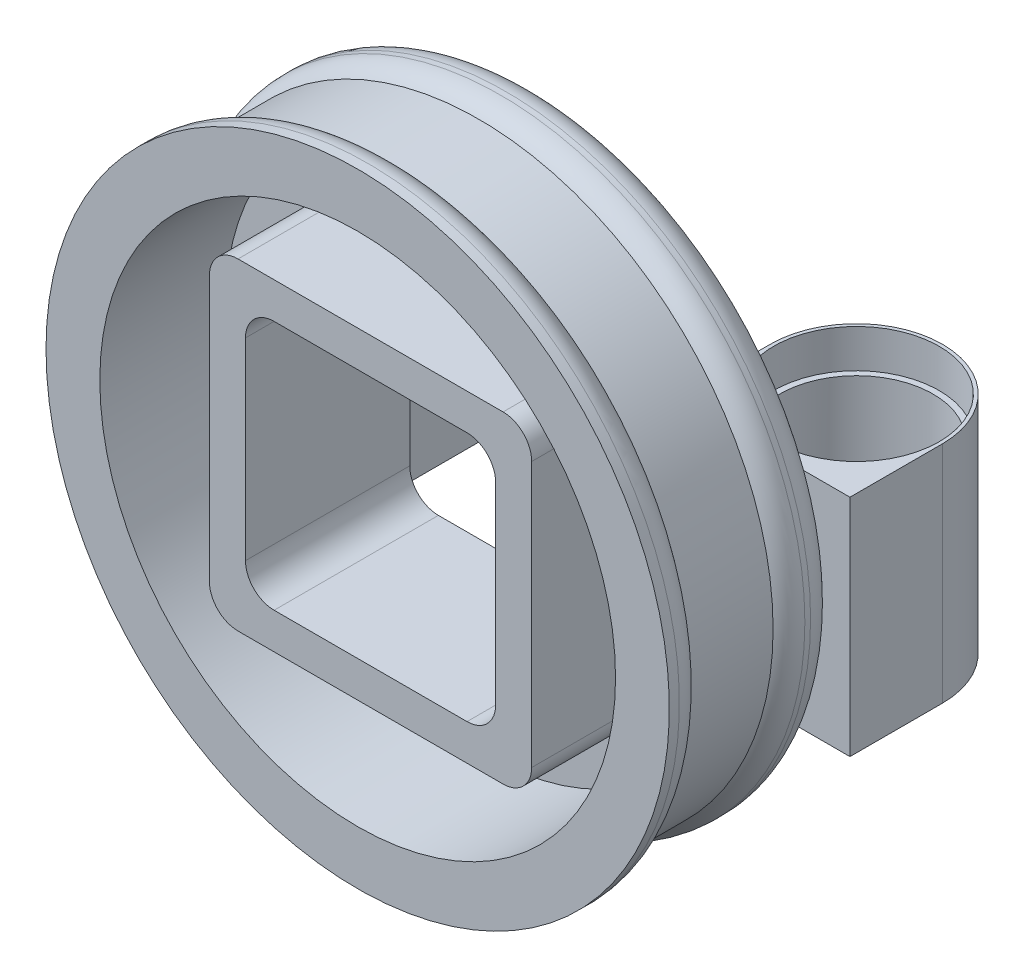
from build123d import *

# Parameters (mm, degrees)
FILLET3_R           = 1
CUT_EXTRUDE6_START  = -3.94
CUT_EXTRUDE6_DEPTH  = 3.94
FILLET5_R           = 1
CUT_EXTRUDE7_DEPTH  = 10.94
SKETCH14_W          = 7.26
SKETCH14_H          = 7.85
BOSS_EXTRUDE2_DEPTH = 6.47
CUT_EXTRUDE16_DEPTH = 16.47
SKETCH19_R          = 2.891830788
SKETCH19_R_2        = 2.68
CUT_EXTRUDE20_DEPTH = 1.34
CUT_EXTRUDE21_START = -1.34
SKETCH21_R          = 2.89
SKETCH21_R_2        = 2.68
CUT_EXTRUDE21_DEPTH = 1.34
SKETCH23_R          = 2.68
CUT_EXTRUDE22_DEPTH = 21.34


with BuildPart() as part:
    # Sketch1 → Revolve1 (revolve)
    with BuildSketch(Plane(origin=(0, 0, 0), x_dir=(1, 0, 0), z_dir=(0, 1, 0)), mode=Mode.PRIVATE) as revolve1_sk:
        Polygon((0, 5.74), (10.635, 5.74), (10.635, 3.78), (10.285, 3.78), (10.285, 0.82), (10.89, 0.82), (10.89, -0.45), (9.01, -0.45), (9.01, 0), (0, 0), align=None)
    revolve(revolve1_sk.sketch.rotate(Axis((0, 0, -20.772745763), (0, 0, 1)), 180), axis=Axis((0, 0, -20.772745763), (0, 0, 1)))

    # Fillet3
    # the kernel refuses this fillet: 1 mm, written as the material it takes off along each edge
    with BuildSketch(Plane(origin=(0, 0, -3.78), x_dir=(-1, 0, 0), z_dir=(0, 1, 0))) as fillet3_piece_1:
        with BuildLine():
            CenterArc((9.635, -0.759934208), FILLET3_R, 0, 49.458398126)
            Line((10.285, 0), (10.298, 0.015198684))
            ThreePointArc((10.298, 0.015198684), (10.46, 0.02), (10.635, 0.02))
            Line((10.635, 0.02), (10.655, 0))
            Line((10.655, 0), (10.655, -0.759934208))
            Line((10.655, -0.759934208), (10.635, -0.759934208))
        make_face()
    revolve(axis=Axis((0, 0, -3.78), (0, 0, 1)), mode=Mode.SUBTRACT)
    with BuildSketch(Plane(origin=(0, 0, -5.74), x_dir=(-1, 0, 0), z_dir=(0, 1, 0))) as fillet3_piece_2:
        with BuildLine():
            CenterArc((10.635 - FILLET3_R, FILLET3_R), FILLET3_R, 270, 90)
            Line((10.635, FILLET3_R), (10.635 + FILLET3_R * 0.02, FILLET3_R))
            Line((10.635 + FILLET3_R * 0.02, FILLET3_R), (10.635 + FILLET3_R * 0.02, -FILLET3_R * 0.02))
            Line((10.635 + FILLET3_R * 0.02, -FILLET3_R * 0.02), (10.635 - FILLET3_R, -FILLET3_R * 0.02))
            Line((10.635 - FILLET3_R, -FILLET3_R * 0.02), (10.635 - FILLET3_R, 0))
        make_face()
    revolve(axis=Axis((0, 0, -5.74), (0, 0, 1)), mode=Mode.SUBTRACT)
    with BuildSketch(Plane(origin=(0, 0, -0.82), x_dir=(-1, 0, 0), z_dir=(0, 1, 0))) as fillet3_piece_3:
        with BuildLine():
            CenterArc((9.89, 0.91868112), FILLET3_R, 293.265974062, 66.734025938)
            Line((10.89, 0.91868112), (10.91, 0.91868112))
            Line((10.91, 0.91868112), (10.91, 0))
            Line((10.91, 0), (10.89, -0.02))
            ThreePointArc((10.89, -0.02), (10.5875, -0.02), (10.2929, -0.018373622))
            Line((10.2929, -0.018373622), (10.285, 0))
        make_face()
    revolve(axis=Axis((0, 0, -0.82), (0, 0, 1)), mode=Mode.SUBTRACT)

    # Sketch13 → Cut-Extrude6 (cut)
    with BuildSketch(Plane.XY.offset(CUT_EXTRUDE6_START)):
        with BuildLine():
            Line((-5.63, -5.63), (-5.63, 5.63))
            Line((-5.63, 5.63), (-5.63, 7.034429614))
            ThreePointArc((-5.63, 7.034429614), (-9.01, 0), (-5.63, -7.034429614))
            Line((-5.63, -7.034429614), (-5.63, -5.63))
        make_face()
        with BuildLine():
            Line((5.63, -5.63), (-5.63, -5.63))
            Line((-5.63, -5.63), (-5.63, -7.034429614))
            ThreePointArc((-5.63, -7.034429614), (0, -9.01), (5.63, -7.034429614))
            Line((5.63, -7.034429614), (5.63, -5.63))
        make_face()
        with BuildLine():
            Line((5.63, 7.034429614), (5.63, 5.63))
            Line((5.63, 5.63), (5.63, -5.63))
            Line((5.63, -5.63), (5.63, -7.034429614))
            ThreePointArc((5.63, -7.034429614), (8.121157553, -3.902166065), (9.01, 0))
            ThreePointArc((9.01, 0), (8.121157553, 3.902166065), (5.63, 7.034429614))
        make_face()
        with BuildLine():
            Line((-5.63, 7.034429614), (-5.63, 5.63))
            Line((-5.63, 5.63), (5.63, 5.63))
            Line((5.63, 5.63), (5.63, 7.034429614))
            ThreePointArc((5.63, 7.034429614), (0, 9.01), (-5.63, 7.034429614))
        make_face()
    extrude(amount=CUT_EXTRUDE6_DEPTH, mode=Mode.SUBTRACT)

    # Fillet5
    fillet5_edges = [part.edges().sort_by_distance(p)[0] for p in [
        (-5.63, 5.63, -1.97),
        (-5.63, -5.63, -1.97),
        (5.63, -5.63, -1.97),
        (5.63, 5.63, -1.97),
    ]]
    fillet(fillet5_edges, radius=FILLET5_R)

    # 3DSketch1 → Cut-Extrude7 (cut)
    with BuildSketch(Plane(origin=(-4.37, -4.37, 0), x_dir=(0.7071067811865485, 0.7071067811865467, 0), z_dir=(0, 0, -1))):
        with BuildLine():
            Line((0.707106781, 0.707106781), (5.473006486, 5.473006486))
            ThreePointArc((5.473006486, 5.473006486), (6.180113268, 5.765899705), (6.887220049, 5.473006486))
            Line((6.887220049, 5.473006486), (11.653119754, 0.707106781))
            ThreePointArc((11.653119754, 0.707106781), (11.946012973, 0), (11.653119754, -0.707106781))
            Line((11.653119754, -0.707106781), (6.887220049, -5.473006486))
            ThreePointArc((6.887220049, -5.473006486), (6.180113268, -5.765899705), (5.473006486, -5.473006486))
            Line((5.473006486, -5.473006486), (0.707106781, -0.707106781))
            ThreePointArc((0.707106781, -0.707106781), (0.414213562, 0), (0.707106781, 0.707106781))
        make_face()
    extrude(amount=CUT_EXTRUDE7_DEPTH, mode=Mode.SUBTRACT)

    # Sketch14 → Boss-Extrude2 (add)
    with BuildSketch(Plane(origin=(0, 0, -5.74), x_dir=(-1, 0, 0), z_dir=(0, 0, -1))):
        with Locations((-8, -0.555)):
            Rectangle(SKETCH14_W, SKETCH14_H)
        with Locations((8, -0.555)):
            Rectangle(SKETCH14_W, SKETCH14_H)
    extrude(amount=BOSS_EXTRUDE2_DEPTH)

    # Sketch16 → Cut-Extrude16 (cut)
    with BuildSketch(Plane.XZ.offset(4.48)):
        with BuildLine():
            ThreePointArc((-4.99, -8.975), (-8, -11.985), (-11.01, -8.975))
            Line((-11.01, -8.975), (-11.01, -5.74))
            Line((-11.01, -5.74), (-11.63, -5.74))
            Line((-11.63, -5.74), (-11.63, -12.21))
            Line((-11.63, -12.21), (-4.37, -12.21))
            Line((-4.37, -12.21), (-4.37, -5.74))
            Line((-4.37, -5.74), (-4.99, -5.74))
            Line((-4.99, -5.74), (-4.99, -8.975))
        make_face()
        with BuildLine():
            ThreePointArc((11.01, -8.975), (8, -11.985), (4.99, -8.975))
            Line((4.99, -8.975), (4.99, -5.74))
            Line((4.99, -5.74), (4.37, -5.74))
            Line((4.37, -5.74), (4.37, -12.21))
            Line((4.37, -12.21), (11.63, -12.21))
            Line((11.63, -12.21), (11.63, -5.74))
            Line((11.63, -5.74), (11.01, -5.74))
            Line((11.01, -5.74), (11.01, -8.975))
        make_face()
    extrude(amount=-CUT_EXTRUDE16_DEPTH, mode=Mode.SUBTRACT)

    # Sketch19 → Cut-Extrude20 (cut)
    # profile 1 of 2: a face of its own
    with BuildSketch(Plane(origin=(0, 3.37, 0), x_dir=(1, 0, 0), z_dir=(0, 1, 0))):
        with Locations(Location((-8, 8.975, 0), (0, 0, 180))):
            Circle(SKETCH19_R)
        with Locations(Location((-8, 8.975, 0), (0, 0, 180))):
            Circle(SKETCH19_R_2, mode=Mode.SUBTRACT)
    # profile 2 of 2: a face of its own
    with BuildSketch(Plane(origin=(0, 3.37, 0), x_dir=(1, 0, 0), z_dir=(0, 1, 0))):
        with Locations((8, 8.975)):
            Circle(SKETCH19_R)
        with Locations((8, 8.975)):
            Circle(SKETCH19_R_2, mode=Mode.SUBTRACT)
    extrude(amount=-CUT_EXTRUDE20_DEPTH, mode=Mode.SUBTRACT)

    # Sketch21 → Cut-Extrude21 (cut)
    # profile 1 of 2: a face of its own
    with BuildSketch(Plane.XZ.offset(4.48).offset(CUT_EXTRUDE21_START)):
        with Locations(Location((-8, -8.975, 0), (0, 0, 270))):
            Circle(SKETCH21_R)
        with Locations(Location((-8, -8.975, 0), (0, 0, 180))):
            Circle(SKETCH21_R_2, mode=Mode.SUBTRACT)
    # profile 2 of 2: a face of its own
    with BuildSketch(Plane.XZ.offset(4.48).offset(CUT_EXTRUDE21_START)):
        with Locations(Location((8, -8.975, 0), (0, 0, 90))):
            Circle(SKETCH21_R)
        with Locations((8, -8.975)):
            Circle(SKETCH21_R_2, mode=Mode.SUBTRACT)
    extrude(amount=CUT_EXTRUDE21_DEPTH, mode=Mode.SUBTRACT)

    # Sketch23 → Cut-Extrude22 (cut)
    with BuildSketch(Plane(origin=(0, 3.37, 0), x_dir=(1, 0, 0), z_dir=(0, 1, 0))):
        with Locations(Location((-8, 8.975, 0), (0, 0, 180))):
            Circle(SKETCH23_R)
        with Locations(Location((8, 8.975, 0), (0, 0, 270))):
            Circle(SKETCH23_R)
    extrude(amount=-CUT_EXTRUDE22_DEPTH, mode=Mode.SUBTRACT)


solid = part.part
